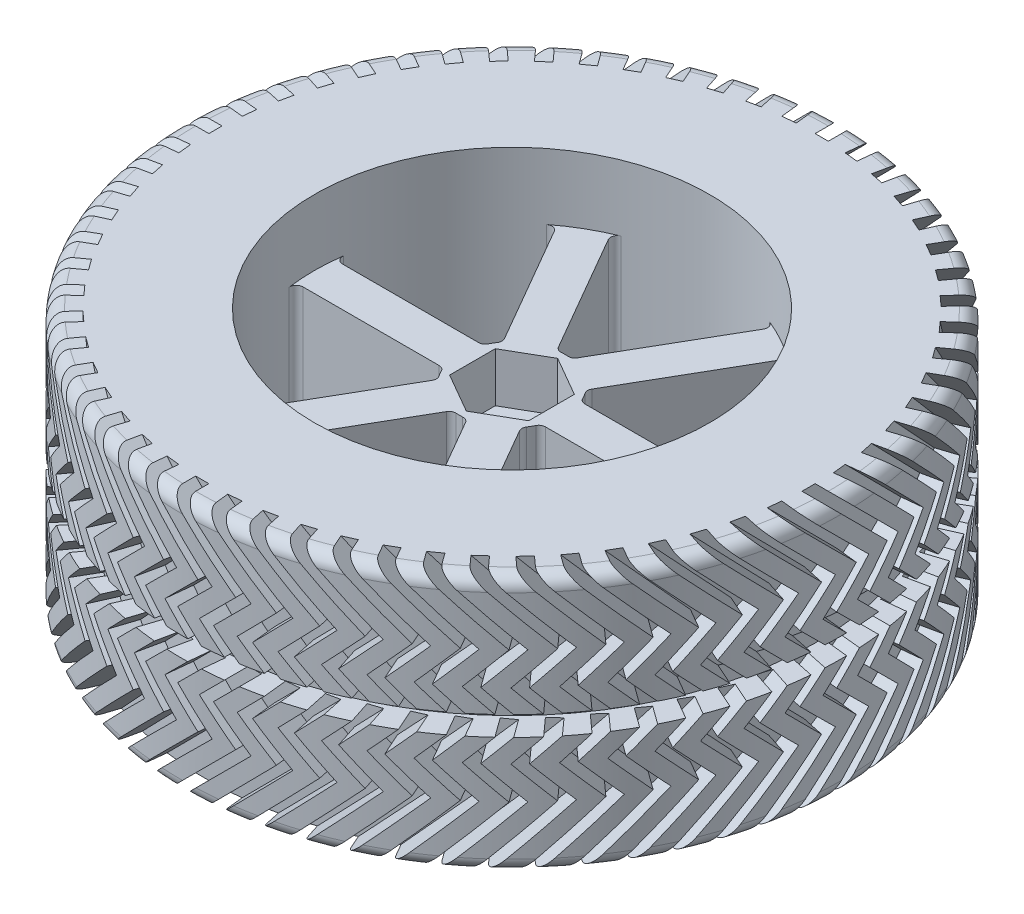
from build123d import *

# Parameters (mm, degrees)
SKETCH3_R           = 50
BOSS_EXTRUDE1_DEPTH = 39
SKETCH4_W           = 30
SKETCH4_H           = 10
CUT_EXTRUDE1_DEPTH  = 7.5
CUT_EXTRUDE2_DEPTH  = 77.426435217
SKETCH7_R           = 2
CUT_EXTRUDE3_DEPTH  = 74.907036201
FILLET1_R           = 2
CUT_EXTRUDE4_START  = 50
CUT_EXTRUDE4_DEPTH  = 4
CIRPATTERN1_COUNT   = 60
SKETCH9_W           = 8
SKETCH9_H           = 3


with BuildPart() as part:
    # Sketch3 → Boss-Extrude1 (new body)
    with BuildSketch(Plane(origin=(0, 0, 0), x_dir=(1, 0, 0), z_dir=(0, 1, 0))):
        Circle(SKETCH3_R)
    extrude(amount=BOSS_EXTRUDE1_DEPTH)

    # Sketch4 → Cut-Revolve1 (revolve, cut)
    with BuildSketch(Plane.XY):
        with Locations((-15, 34)):
            Rectangle(SKETCH4_W, SKETCH4_H)
        with Locations((-15, 5)):
            Rectangle(SKETCH4_W, SKETCH4_H)
    revolve(axis=Axis((0, 0, 0), (0, -1, 0)), mode=Mode.SUBTRACT)

    # Sketch5 → Cut-Extrude1 (cut)
    with BuildSketch(Plane(origin=(0, 29, 0), x_dir=(1, 0, 0), z_dir=(0, 1, 0))):
        Polygon((0, 6.92820323), (-6, 3.464101615), (-6, -3.464101615), (0, -6.92820323), (6, -3.464101615), (6, 3.464101615), align=None)
    extrude(amount=-CUT_EXTRUDE1_DEPTH, mode=Mode.SUBTRACT)

    # Sketch6 → Cut-Extrude2 (cut, through all)
    with BuildSketch(Plane(origin=(0, 29, 0), x_dir=(1, 0, 0), z_dir=(0, 1, 0))):
        with BuildLine():
            Line((-28.722813233, 3), (-8.062257748, 3))
            ThreePointArc((-8.062257748, 3), (-7.535211472, 3.150163414), (-7.166451332, 3.555555556))
            ThreePointArc((-7.166451332, 3.555555556), (-6.92820323, 4), (-6.662427102, 4.428551131))
            ThreePointArc((-6.662427102, 4.428551131), (-6.495727279, 4.95060285), (-6.629205086, 5.482120022))
            Line((-6.629205086, 5.482120022), (-16.959482828, 23.374685928))
            ThreePointArc((-16.959482828, 23.374685928), (-17.634083714, 23.856193265), (-18.440180929, 23.663468201))
            ThreePointArc((-18.440180929, 23.663468201), (-25.980762114, 15), (-29.713255068, 4.137931034))
            ThreePointArc((-29.713255068, 4.137931034), (-29.477111262, 3.343467836), (-28.722813233, 3))
        make_face()
        with BuildLine():
            Line((11.763330405, 26.374685928), (1.433052663, 8.482120022))
            ThreePointArc((1.433052663, 8.482120022), (1.039484193, 8.100766264), (0.50402423, 7.984106686))
            ThreePointArc((0.50402423, 7.984106686), (0, 8), (-0.50402423, 7.984106686))
            ThreePointArc((-0.50402423, 7.984106686), (-1.039484193, 8.100766264), (-1.433052663, 8.482120022))
            Line((-1.433052663, 8.482120022), (-11.763330405, 26.374685928))
            ThreePointArc((-11.763330405, 26.374685928), (-11.843027549, 27.199661101), (-11.273074139, 27.801399236))
            ThreePointArc((-11.273074139, 27.801399236), (0, 30), (11.273074139, 27.801399236))
            ThreePointArc((11.273074139, 27.801399236), (11.843027549, 27.199661101), (11.763330405, 26.374685928))
        make_face()
        with BuildLine():
            Line((28.722813233, 3), (8.062257748, 3))
            ThreePointArc((8.062257748, 3), (7.535211472, 3.150163414), (7.166451332, 3.555555556))
            ThreePointArc((7.166451332, 3.555555556), (6.92820323, 4), (6.662427102, 4.428551131))
            ThreePointArc((6.662427102, 4.428551131), (6.495727279, 4.95060285), (6.629205086, 5.482120022))
            Line((6.629205086, 5.482120022), (16.959482828, 23.374685928))
            ThreePointArc((16.959482828, 23.374685928), (17.634083714, 23.856193265), (18.440180929, 23.663468201))
            ThreePointArc((18.440180929, 23.663468201), (25.980762114, 15), (29.713255068, 4.137931034))
            ThreePointArc((29.713255068, 4.137931034), (29.477111262, 3.343467836), (28.722813233, 3))
        make_face()
        with BuildLine():
            Line((16.959482828, -23.374685928), (6.629205086, -5.482120022))
            ThreePointArc((6.629205086, -5.482120022), (6.495727279, -4.95060285), (6.662427102, -4.428551131))
            ThreePointArc((6.662427102, -4.428551131), (6.92820323, -4), (7.166451332, -3.555555556))
            ThreePointArc((7.166451332, -3.555555556), (7.535211472, -3.150163414), (8.062257748, -3))
            Line((8.062257748, -3), (28.722813233, -3))
            ThreePointArc((28.722813233, -3), (29.477111262, -3.343467836), (29.713255068, -4.137931034))
            ThreePointArc((29.713255068, -4.137931034), (25.980762114, -15), (18.440180929, -23.663468201))
            ThreePointArc((18.440180929, -23.663468201), (17.634083714, -23.856193265), (16.959482828, -23.374685928))
        make_face()
        with BuildLine():
            Line((-11.763330405, -26.374685928), (-1.433052663, -8.482120022))
            ThreePointArc((-1.433052663, -8.482120022), (-1.039484193, -8.100766264), (-0.50402423, -7.984106686))
            ThreePointArc((-0.50402423, -7.984106686), (0, -8), (0.50402423, -7.984106686))
            ThreePointArc((0.50402423, -7.984106686), (1.039484193, -8.100766264), (1.433052663, -8.482120022))
            Line((1.433052663, -8.482120022), (11.763330405, -26.374685928))
            ThreePointArc((11.763330405, -26.374685928), (11.843027549, -27.199661101), (11.273074139, -27.801399236))
            ThreePointArc((11.273074139, -27.801399236), (0, -30), (-11.273074139, -27.801399236))
            ThreePointArc((-11.273074139, -27.801399236), (-11.843027549, -27.199661101), (-11.763330405, -26.374685928))
        make_face()
        with BuildLine():
            Line((-28.722813233, -3), (-8.062257748, -3))
            ThreePointArc((-8.062257748, -3), (-7.535211472, -3.150163414), (-7.166451332, -3.555555556))
            ThreePointArc((-7.166451332, -3.555555556), (-6.92820323, -4), (-6.662427102, -4.428551131))
            ThreePointArc((-6.662427102, -4.428551131), (-6.495727279, -4.95060285), (-6.629205086, -5.482120022))
            Line((-6.629205086, -5.482120022), (-16.959482828, -23.374685928))
            ThreePointArc((-16.959482828, -23.374685928), (-17.634083714, -23.856193265), (-18.440180929, -23.663468201))
            ThreePointArc((-18.440180929, -23.663468201), (-25.980762114, -15), (-29.713255068, -4.137931034))
            ThreePointArc((-29.713255068, -4.137931034), (-29.477111262, -3.343467836), (-28.722813233, -3))
        make_face()
    extrude(amount=-CUT_EXTRUDE2_DEPTH, mode=Mode.SUBTRACT)

    # Sketch7 → Cut-Extrude3 (cut, through all)
    with BuildSketch(Plane(origin=(0, 21.5, 0), x_dir=(1, 0, 0), z_dir=(0, 1, 0))):
        Circle(SKETCH7_R)
    extrude(amount=-CUT_EXTRUDE3_DEPTH, mode=Mode.SUBTRACT)

    # Fillet1
    fillet1_edges = [part.edges().sort_by_distance(p)[0] for p in [
        (-50, 0, 0),
        (-50, 39, 0),
    ]]
    fillet(fillet1_edges, radius=FILLET1_R)

    # Sketch8 → Cut-Extrude4 (cut)
    with BuildSketch(Plane.XY.offset(CUT_EXTRUDE4_START)):
        Polygon((0, 39), (9.5, 29.5), (4.5, 24.5), (9.5, 19.5), (4.5, 14.5), (9.5, 9.5), (0, 0), (-2, 0), (7.5, 9.5), (2.5, 14.5), (7.5, 19.5), (2.5, 24.5), (7.5, 29.5), (-2, 39), align=None)
    cut_extrude4 = extrude(amount=-CUT_EXTRUDE4_DEPTH, mode=Mode.SUBTRACT)

    # CirPattern1: Cut-Extrude4 ×60 about axis
    cirpattern1_axis = Axis((0, 39, 0), (0, 1, 0))
    for i in range(1, CIRPATTERN1_COUNT):
        add(cut_extrude4.rotate(cirpattern1_axis, i * 360 / CIRPATTERN1_COUNT), mode=Mode.SUBTRACT)

    # Sketch9 → Cut-Revolve2 (revolve, cut)
    with BuildSketch(Plane.XY):
        with Locations((-49.947457041, 19.5)):
            Rectangle(SKETCH9_W, SKETCH9_H)
    revolve(axis=Axis((0, 0, 0), (0, -1, 0)), mode=Mode.SUBTRACT)


solid = part.part
